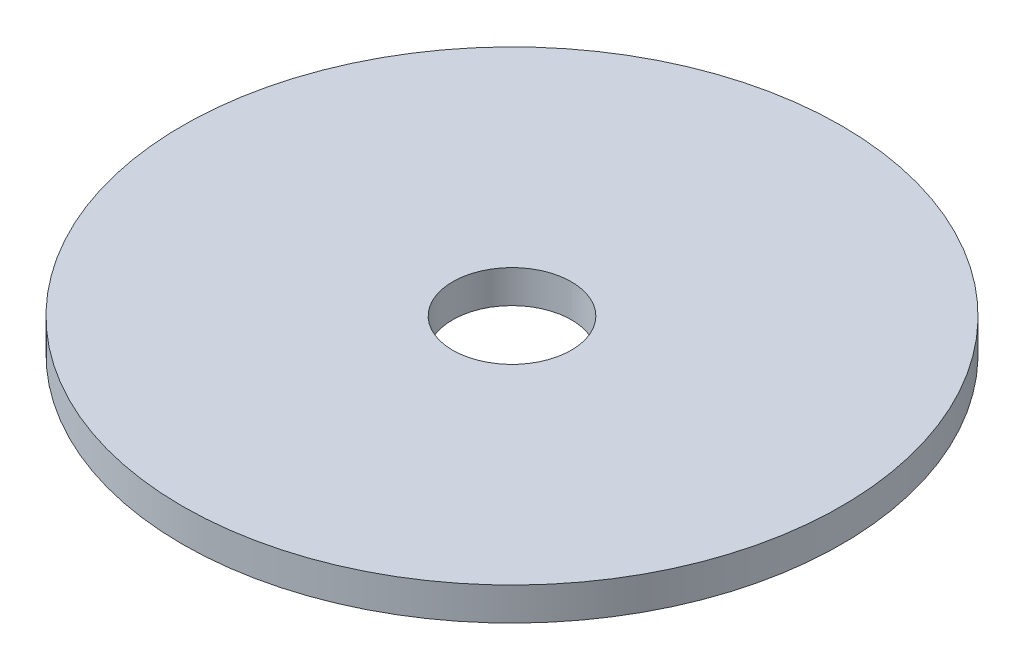
from build123d import *

# Parameters (mm, degrees)
SKETCH1_R           = 20
SKETCH1_R_2         = 3.6
BOSS_EXTRUDE2_DEPTH = 2


with BuildPart() as part:
    # Sketch1 → Boss-Extrude2 (new body)
    with BuildSketch(Plane(origin=(0, 0, 0), x_dir=(1, 0, 0), z_dir=(0, 1, 0))):
        Circle(SKETCH1_R)
        Circle(SKETCH1_R_2, mode=Mode.SUBTRACT)
    extrude(amount=BOSS_EXTRUDE2_DEPTH)


solid = part.part
